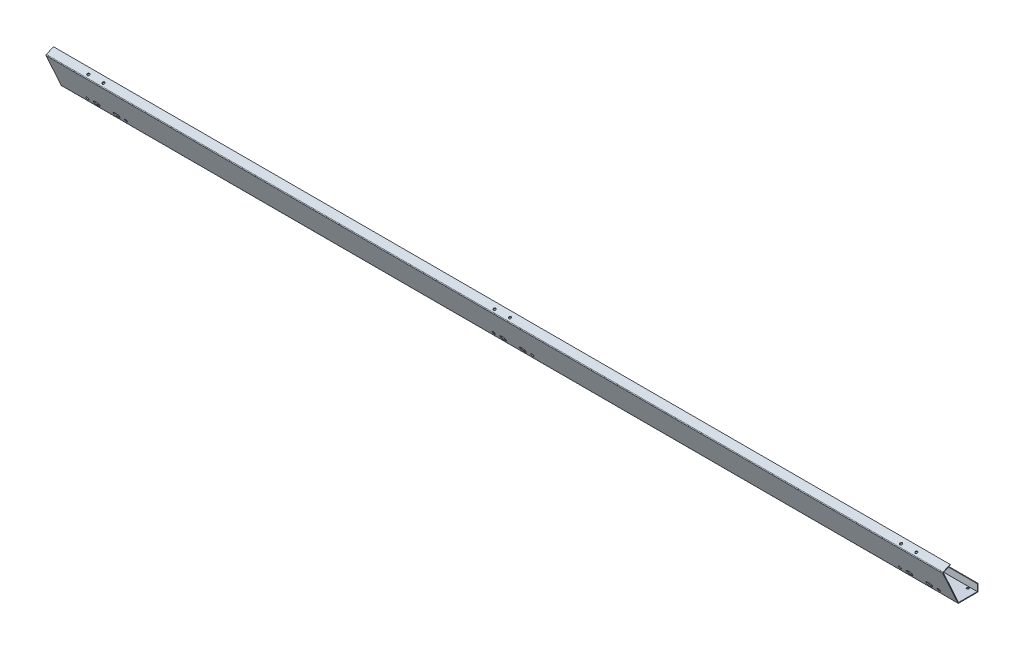
from build123d import *

# Parameters (mm, degrees)
SKETCH1_W                    = 5340
SKETCH1_H                    = 45
BASE_FLANGE1_DEPTH           = 4
EDGE_FLANGE1_STRIP_W         = 16.4
EDGE_FLANGE1_STRIP_H         = 4
EDGE_FLANGE1_STRIP_CUT_DEPTH = 5340
EDGE_FLANGE1_DEPTH           = 5340
EDGE_FLANGE2_START           = -2670
EDGE_FLANGE2_DEPTH           = 5340
EDGE_FLANGE2_2_DEPTH         = 5340
EDGE_FLANGE3_STRIP_W         = 16.4
EDGE_FLANGE3_STRIP_H         = 4
EDGE_FLANGE3_STRIP_CUT_DEPTH = 5340
EDGE_FLANGE3_DEPTH           = 5340
SKETCH15_R                   = 7
CUT_EXTRUDE1_DEPTH           = 10
SKETCH17_R                   = 6.5
CUT_EXTRUDE3_DEPTH           = 10
LPATTERN1_COUNT              = 30
LPATTERN1_PITCH              = 178
SKETCH18_R                   = 9
CUT_EXTRUDE4_DEPTH           = 10
LPATTERN2_COUNT              = 3
LPATTERN2_PITCH              = 2420
LPATTERN3_COUNT              = 3
LPATTERN3_PITCH              = 2420


# Read off the part's stored shape, not the designer's step: Edge-Flange2
# Sheet-metal steps are written as plain solids
with BuildPart() as part:
    # Sketch1 → Base-Flange1 (new body)
    with BuildSketch(Plane.XY):
        Rectangle(SKETCH1_W, SKETCH1_H)
    extrude(amount=-BASE_FLANGE1_DEPTH)

    # Edge-Flange1 strip (across the edge) → Edge-Flange1 strip cut (cut)
    with BuildSketch(Plane(origin=(-2670, -22.5, 0), x_dir=(0, 1, 0), z_dir=(1, 0, 0))):
        with Locations((-4, -2)):
            Rectangle(EDGE_FLANGE1_STRIP_W, EDGE_FLANGE1_STRIP_H)
    extrude(amount=EDGE_FLANGE1_STRIP_CUT_DEPTH, mode=Mode.SUBTRACT)

    # Edge-Flange1 section (across the edge) → Edge-Flange1 (add)
    with BuildSketch(Plane(origin=(-2670, -22.5, 0), x_dir=(0, 1, 0), z_dir=(1, 0, 0))):
        with BuildLine():
            Line((0, 0.2), (0, 116))
            Line((0, 116), (4, 116))
            Line((4, 116), (4, 0.2))
            ThreePointArc((4, 0.2), (4.058578644, 0.058578644), (4.2, 0))
            Line((4.2, 0), (4.2, -4))
            ThreePointArc((4.2, -4), (1.230151519, -2.769848481), (0, 0.2))
        make_face()
    extrude(amount=EDGE_FLANGE1_DEPTH)

    # Edge-Flange2 outline → Edge-Flange2 (cut)
    with BuildSketch(Plane.YZ.offset(EDGE_FLANGE2_START)):
        with BuildLine():
            ThreePointArc((-22.5, 111.475564199), (-21.832363854, 113.747656979), (-20.041711619, 115.297401537))
            Line((-20.041711619, 115.297401537), (-18.5, 116))
            Line((-18.5, 116), (-22.5, 116))
            Line((-22.5, 116), (-22.5, 111.475564199))
        make_face()
    extrude(amount=EDGE_FLANGE2_DEPTH, mode=Mode.SUBTRACT)

    # Edge-Flange2 2 outline → Edge-Flange2 2 (add)
    with BuildSketch(Plane.YZ.offset(EDGE_FLANGE2_START)):
        with BuildLine():
            Line((182.241285947, 207.483074576), (-18.5, 116))
            Line((-18.5, 116), (-18.5, 111.475564199))
            ThreePointArc((-18.5, 111.475564199), (-18.468207803, 111.583759093), (-18.382938649, 111.657556453))
            Line((-18.382938649, 111.657556453), (183.900058918, 203.843229492))
            Line((183.900058918, 203.843229492), (182.241285947, 207.483074576))
        make_face()
    extrude(amount=EDGE_FLANGE2_2_DEPTH)

    # Edge-Flange3 strip (across the edge) → Edge-Flange3 strip cut (cut)
    with BuildSketch(Plane(origin=(-2670, 183.900058918, 203.843229492), x_dir=(0, -0.9099612708765384, -0.41469324265624946), z_dir=(1, 0, 0))):
        with Locations((-4, -2)):
            Rectangle(EDGE_FLANGE3_STRIP_W, EDGE_FLANGE3_STRIP_H)
    extrude(amount=EDGE_FLANGE3_STRIP_CUT_DEPTH, mode=Mode.SUBTRACT)

    # Edge-Flange3 section (across the edge) → Edge-Flange3 (add)
    with BuildSketch(Plane(origin=(-2670, 183.900058918, 203.843229492), x_dir=(0, -0.9099612708765384, -0.41469324265624946), z_dir=(1, 0, 0))):
        with BuildLine():
            Line((0, 0.2), (0, 46))
            Line((0, 46), (4, 46))
            Line((4, 46), (4, 0.2))
            ThreePointArc((4, 0.2), (4.058578644, 0.058578644), (4.2, 0))
            Line((4.2, 0), (4.2, -4))
            ThreePointArc((4.2, -4), (1.230151519, -2.769848481), (0, 0.2))
        make_face()
    extrude(amount=EDGE_FLANGE3_DEPTH)

    # Sketch15 → Cut-Extrude1 (cut)
    with BuildSketch(Plane(origin=(0, 229.195895582, 104.450587277), x_dir=(1, 0, 0), z_dir=(0, 0.9099612708765383, 0.41469324265624985))):
        with Locations(Location((-2435, -93.227332411, 0), (0, 0, 270))):
            Circle(SKETCH15_R)
        with Locations(Location((-2345, -91.902677897, 0), (0, 0, 270))):
            Circle(SKETCH15_R)
    cut_extrude1 = extrude(amount=-CUT_EXTRUDE1_DEPTH, mode=Mode.SUBTRACT)

    # Sketch17 → Cut-Extrude3 (cut)
    with BuildSketch(Plane.XZ.offset(22.5)):
        with Locations(Location((-2538, 11, 0), (0, 0, 270))):
            Circle(SKETCH17_R)
    cut_extrude3 = extrude(amount=-CUT_EXTRUDE3_DEPTH, mode=Mode.SUBTRACT)

    # LPattern1: Cut-Extrude3 ×30
    with Locations(*[(i * LPATTERN1_PITCH, 0, 0) for i in range(1, LPATTERN1_COUNT)]):
        add(cut_extrude3, mode=Mode.SUBTRACT)

    # Sketch18 → Cut-Extrude4 (cut)
    with BuildSketch(Plane(origin=(0, -46.954609635, 103.032487299), x_dir=(1, 0, 0), z_dir=(0, -0.4146932426562464, 0.90996127087654))):
        with Locations(Location((-2275, 52.664953269, 0), (0, 0, 270))):
            Circle(SKETCH18_R)
        with Locations(Location((-2505, 52.664953269, 0), (0, 0, 270))):
            Circle(SKETCH18_R)
        with BuildLine():
            Line((-2324, 40.664953269), (-2338, 40.664953269))
            ThreePointArc((-2338, 40.664953269), (-2350, 52.664953269), (-2338, 64.664953269))
            Line((-2338, 64.664953269), (-2324, 64.664953269))
            ThreePointArc((-2324, 64.664953269), (-2312, 52.664953269), (-2324, 40.664953269))
        make_face()
        with BuildLine():
            Line((-2442, 40.664953269), (-2456, 40.664953269))
            ThreePointArc((-2456, 40.664953269), (-2468, 52.664953269), (-2456, 64.664953269))
            Line((-2456, 64.664953269), (-2442, 64.664953269))
            ThreePointArc((-2442, 64.664953269), (-2430, 52.664953269), (-2442, 40.664953269))
        make_face()
    cut_extrude4 = extrude(amount=-CUT_EXTRUDE4_DEPTH, mode=Mode.SUBTRACT)

    # LPattern2: Cut-Extrude1 ×3
    with Locations(*[(i * LPATTERN2_PITCH, 0, 0) for i in range(1, LPATTERN2_COUNT)]):
        add(cut_extrude1, mode=Mode.SUBTRACT)

    # LPattern3: Cut-Extrude4 ×3
    with Locations(*[(i * LPATTERN3_PITCH, 0, 0) for i in range(1, LPATTERN3_COUNT)]):
        add(cut_extrude4, mode=Mode.SUBTRACT)


solid = part.part
